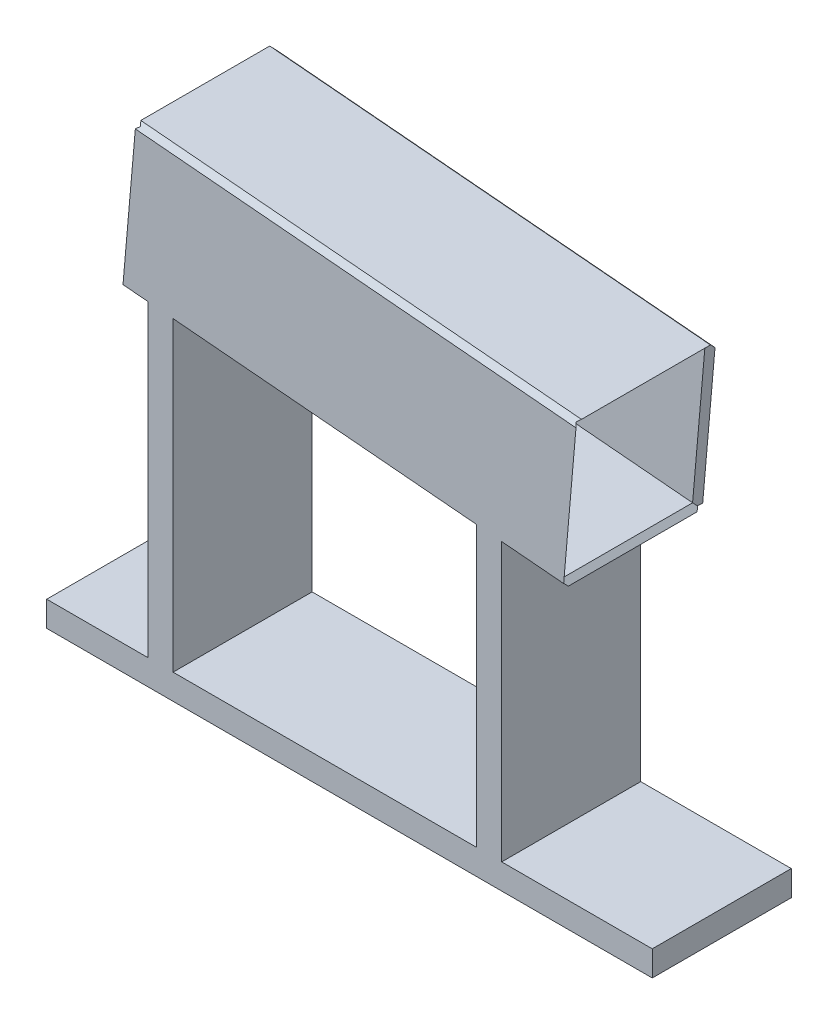
from build123d import *

# Parameters (mm, degrees)
BOSS_EXTRUDE1_DEPTH = 55
SKETCH2_W           = 51
SKETCH2_H           = 56
CUT_EXTRUDE1_DEPTH  = 198.600505619
BOSS_EXTRUDE4_DEPTH = 55
SKETCH7_W           = 239.563416731
SKETCH7_H           = 55
BOSS_EXTRUDE5_DEPTH = 10
CHAMFER6_SIZE       = 2
CHAMFER7_SIZE       = 2
FILLET4_R           = 5
FILLET5_R           = 5
FILLET6_R           = 5
FILLET7_R           = 5


# Some blends are built 0.0001 mm under size
with BuildPart() as part:
    # Sketch1 → Boss-Extrude1 (new body)
    with BuildSketch(Plane.XY):
        Polygon((0, 0), (-174.334072166, 15.252254981), (-169.104727601, 75.023936866), (5.229344565, 59.771681886), align=None)
    extrude(amount=BOSS_EXTRUDE1_DEPTH)

    # Sketch2 → Cut-Extrude1 (cut, through all)
    with BuildSketch(Plane(origin=(0, 0, 0), x_dir=(0, 0, -1), z_dir=(0.9961946980917452, -0.08715574274766201, 0))):
        with Locations((-27.5, 30)):
            Rectangle(SKETCH2_W, SKETCH2_H)
    extrude(amount=-CUT_EXTRUDE1_DEPTH, mode=Mode.SUBTRACT)

    # Sketch3 → Boss-Extrude4 (add)
    with BuildSketch(Plane.XY):
        Polygon((-164.334072166, 14.377368346), (-164.334072166, -105.622631654), (-154.334072166, -105.622631654), (-154.334072166, 13.50248171), align=None)
        Polygon((-34.334072166, 3.003842087), (-34.334072166, -105.622631654), (-24.334072166, -105.622631654), (-24.334072166, 2.128955452), align=None)
    extrude(amount=BOSS_EXTRUDE4_DEPTH)

    # Sketch7 → Boss-Extrude5 (add)
    with BuildSketch(Plane.XZ.offset(105.622631654)):
        with Locations((-84.5523638, 27.5)):
            Rectangle(SKETCH7_W, SKETCH7_H)
    extrude(amount=BOSS_EXTRUDE5_DEPTH)

    # Chamfer6
    chamfer6_edges = [part.edges().sort_by_distance(p)[0] for p in [
        (-169.279039087, 73.03154747, 27.5),
        (-171.719399884, 45.138095924, 53),
        (-174.159760681, 17.244644377, 27.5),
        (-171.719399884, 45.138095924, 2),
        (2.614672282, 29.885840943, 2),
        (5.055033079, 57.779292489, 27.5),
        (2.614672282, 29.885840943, 53),
        (0.174311485, 1.992389396, 27.5),
    ]]
    chamfer(chamfer6_edges, length=CHAMFER6_SIZE - 0.0001)  # a hair under: the kernel refuses the full size

    # Chamfer7
    # the kernel refuses this chamfer: 2 mm, written as the material it takes off along each edge
    with BuildSketch(Plane(origin=(-159.21027825, 13.929094464, 55), x_dir=(-0.0023964235484937708, -0.027391246498851614, -0.9996219169112968), z_dir=(-0.9961946980917452, 0.08715574274766169, 0))) as chamfer7_piece_1_section:
        Polygon((CHAMFER7_SIZE * 0.999621916911, -CHAMFER7_SIZE * 0.0274958766106), (-CHAMFER7_SIZE * 0.0274958766106, -CHAMFER7_SIZE * 0.999621916911), (0, 0), align=None)
    chamfer7_piece_1 = extrude(amount=20.324930327, mode=Mode.PRIVATE)
    chamfer7_piece_1 = split(chamfer7_piece_1, bisect_by=Plane(origin=(-164.334072166, 15.69707124, 54.339627198), z_dir=(-1, 0, 0)), keep=Keep.TOP, mode=Mode.PRIVATE)
    add(chamfer7_piece_1, mode=Mode.SUBTRACT)
    with BuildSketch(Plane(origin=(-29.21027825, 2.555568205, 0), x_dir=(0.08712279063524543, 0.9958180537233409, -0.02749587661058642), z_dir=(-0.9961946980917452, 0.08715574274766169, 0))) as chamfer7_piece_2_section:
        Polygon((CHAMFER7_SIZE * 0.999621916911, -CHAMFER7_SIZE * 0.0274958766106), (-CHAMFER7_SIZE * 0.0274958766106, -CHAMFER7_SIZE * 0.999621916911), (0, 0), align=None)
    chamfer7_piece_2 = extrude(amount=130.745112457, mode=Mode.PRIVATE)
    chamfer7_piece_2 = split(chamfer7_piece_2, bisect_by=Plane(origin=(-34.334072166, 8.915268669, 0.659587254), z_dir=(-1, 0, 0)), keep=Keep.TOP, mode=Mode.PRIVATE)
    chamfer7_piece_2 = split(chamfer7_piece_2, bisect_by=Plane(origin=(-154.334072166, 8.915268669, 0.659587254), z_dir=(1, 0, 0)), keep=Keep.TOP, mode=Mode.PRIVATE)
    add(chamfer7_piece_2, mode=Mode.SUBTRACT)
    with BuildSketch(Plane(origin=(5.123793916, -0.448273882, 0), x_dir=(0.08712279063524543, 0.9958180537233409, -0.027495876610586438), z_dir=(-0.9961946980917452, 0.08715574274766169, 0))) as chamfer7_piece_3_section:
        Polygon((CHAMFER7_SIZE * 0.999621916911, -CHAMFER7_SIZE * 0.0274958766106), (-CHAMFER7_SIZE * 0.0274958766106, -CHAMFER7_SIZE * 0.999621916911), (0, 0), align=None)
    chamfer7_piece_3 = extrude(amount=34.71375632, mode=Mode.PRIVATE)
    chamfer7_piece_3 = split(chamfer7_piece_3, bisect_by=Plane(origin=(-24.334072166, 1.500682903, 0.659186265), z_dir=(1, 0, 0)), keep=Keep.TOP, mode=Mode.PRIVATE)
    add(chamfer7_piece_3, mode=Mode.SUBTRACT)
    with BuildSketch(Plane(origin=(-29.21027825, 2.555568205, 55), x_dir=(0.08712279063524543, 0.9958180537233409, 0.02749587661058574), z_dir=(-0.9961946980917452, 0.08715574274766169, 0))) as chamfer7_piece_4_section:
        Polygon((CHAMFER7_SIZE * 0.999621916911, CHAMFER7_SIZE * 0.0274958766106), (-CHAMFER7_SIZE * 0.0274958766106, CHAMFER7_SIZE * 0.999621916911), (0, 0), align=None)
    chamfer7_piece_4 = extrude(amount=130.745112457, mode=Mode.PRIVATE)
    chamfer7_piece_4 = split(chamfer7_piece_4, bisect_by=Plane(origin=(-34.334072166, 8.915268669, 54.340412746), z_dir=(-1, 0, 0)), keep=Keep.TOP, mode=Mode.PRIVATE)
    chamfer7_piece_4 = split(chamfer7_piece_4, bisect_by=Plane(origin=(-154.334072166, 8.915268669, 54.340412746), z_dir=(1, 0, 0)), keep=Keep.TOP, mode=Mode.PRIVATE)
    add(chamfer7_piece_4, mode=Mode.SUBTRACT)
    with BuildSketch(Plane(origin=(5.123793916, -0.448273882, 55), x_dir=(0.08712279063524543, 0.9958180537233409, 0.02749587661058574), z_dir=(-0.9961946980917452, 0.08715574274766169, 0))) as chamfer7_piece_5_section:
        Polygon((CHAMFER7_SIZE * 0.999621916911, CHAMFER7_SIZE * 0.0274958766106), (-CHAMFER7_SIZE * 0.0274958766106, CHAMFER7_SIZE * 0.999621916911), (0, 0), align=None)
    chamfer7_piece_5 = extrude(amount=34.71375632, mode=Mode.PRIVATE)
    chamfer7_piece_5 = split(chamfer7_piece_5, bisect_by=Plane(origin=(-24.334072166, 1.500682903, 54.340813735), z_dir=(1, 0, 0)), keep=Keep.TOP, mode=Mode.PRIVATE)
    add(chamfer7_piece_5, mode=Mode.SUBTRACT)
    with BuildSketch(Plane(origin=(-159.21027825, 13.929094464, 0), x_dir=(-0.002396423548493694, -0.02739124649885074, 0.9996219169112968), z_dir=(-0.9961946980917452, 0.08715574274766169, 0))) as chamfer7_piece_6_section:
        Polygon((CHAMFER7_SIZE * 0.999621916911, CHAMFER7_SIZE * 0.0274958766106), (-CHAMFER7_SIZE * 0.0274958766106, CHAMFER7_SIZE * 0.999621916911), (0, 0), align=None)
    chamfer7_piece_6 = extrude(amount=20.324930327, mode=Mode.PRIVATE)
    chamfer7_piece_6 = split(chamfer7_piece_6, bisect_by=Plane(origin=(-164.334072166, 15.69707124, 0.660372802), z_dir=(-1, 0, 0)), keep=Keep.TOP, mode=Mode.PRIVATE)
    add(chamfer7_piece_6, mode=Mode.SUBTRACT)
    with BuildSketch(Plane(origin=(-174.228521517, 75.472210748, 0), x_dir=(-0.08712279063524556, -0.9958180537233409, -0.02749587661058637), z_dir=(0.9961946980917452, -0.08715574274766183, 0))) as chamfer7_piece_7:
        Polygon((CHAMFER7_SIZE * 0.999621916911, -CHAMFER7_SIZE * 0.0274958766106), (-CHAMFER7_SIZE * 0.0274958766106, -CHAMFER7_SIZE * 0.999621916911), (0, 0), align=None)
    extrude(amount=185.286731952, mode=Mode.SUBTRACT)
    with BuildSketch(Plane(origin=(-174.228521517, 75.472210748, 55), x_dir=(-0.08712279063524556, -0.9958180537233409, 0.02749587661058563), z_dir=(0.9961946980917452, -0.08715574274766183, 0))) as chamfer7_piece_8:
        Polygon((CHAMFER7_SIZE * 0.999621916911, CHAMFER7_SIZE * 0.0274958766106), (-CHAMFER7_SIZE * 0.0274958766106, CHAMFER7_SIZE * 0.999621916911), (0, 0), align=None)
    extrude(amount=185.286731952, mode=Mode.SUBTRACT)

    # Fillet4
    fillet4_edges = [part.edges().sort_by_distance(p)[0] for p in [
        (-24.334072166, 2.128955452, 27.5),
    ]]
    fillet(fillet4_edges, radius=FILLET4_R)

    # Fillet5
    fillet5_edges = [part.edges().sort_by_distance(p)[0] for p in [
        (-34.334072166, 3.003842087, 27.5),
    ]]
    fillet(fillet5_edges, radius=FILLET5_R)

    # Fillet6
    fillet6_edges = [part.edges().sort_by_distance(p)[0] for p in [
        (-154.334072166, 13.50248171, 27.5),
    ]]
    fillet(fillet6_edges, radius=FILLET6_R)

    # Fillet7
    fillet7_edges = [part.edges().sort_by_distance(p)[0] for p in [
        (-164.334072166, 14.377368346, 27.5),
    ]]
    fillet(fillet7_edges, radius=FILLET7_R)


solid = part.part
